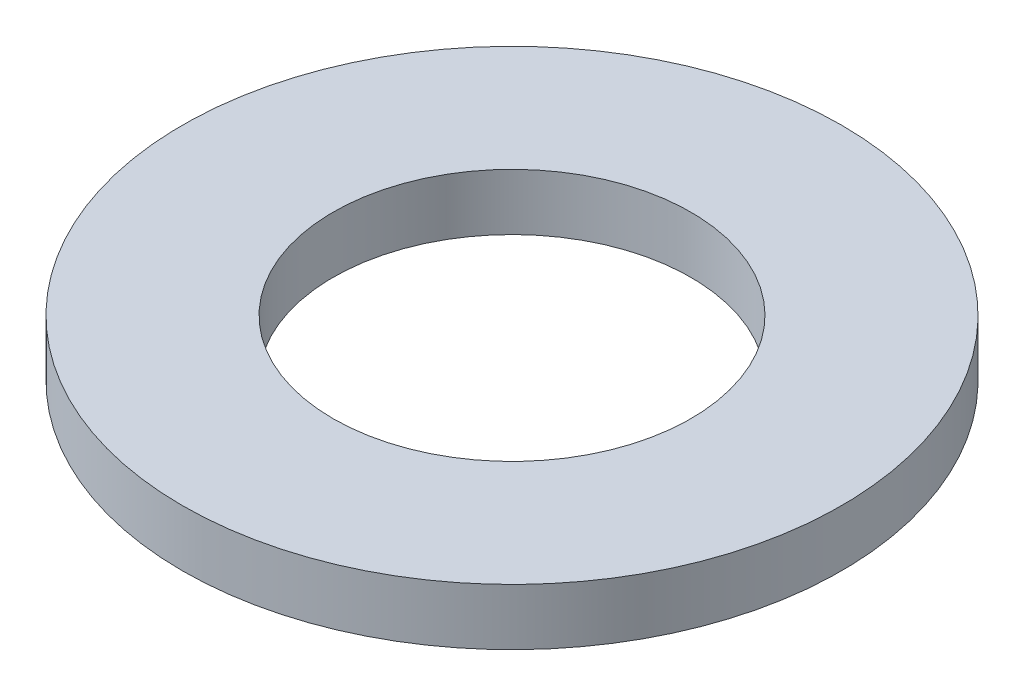
from build123d import *

# Parameters (mm, degrees)
SKETCH1_R           = 87.5
BOSS_EXTRUDE1_DEPTH = 15
SKETCH2_R           = 47.5
CUT_EXTRUDE1_DEPTH  = 125.649508623


with BuildPart() as part:
    # Sketch1 → Boss-Extrude1 (new body)
    with BuildSketch(Plane(origin=(0, 0, 0), x_dir=(1, 0, 0), z_dir=(0, 1, 0))):
        Circle(SKETCH1_R)
    extrude(amount=BOSS_EXTRUDE1_DEPTH)

    # Sketch2 → Cut-Extrude1 (cut, through all)
    with BuildSketch(Plane(origin=(0, 0, 0), x_dir=(1, 0, 0), z_dir=(0, 1, 0))):
        Circle(SKETCH2_R)
    extrude(amount=CUT_EXTRUDE1_DEPTH, mode=Mode.SUBTRACT)


solid = part.part
